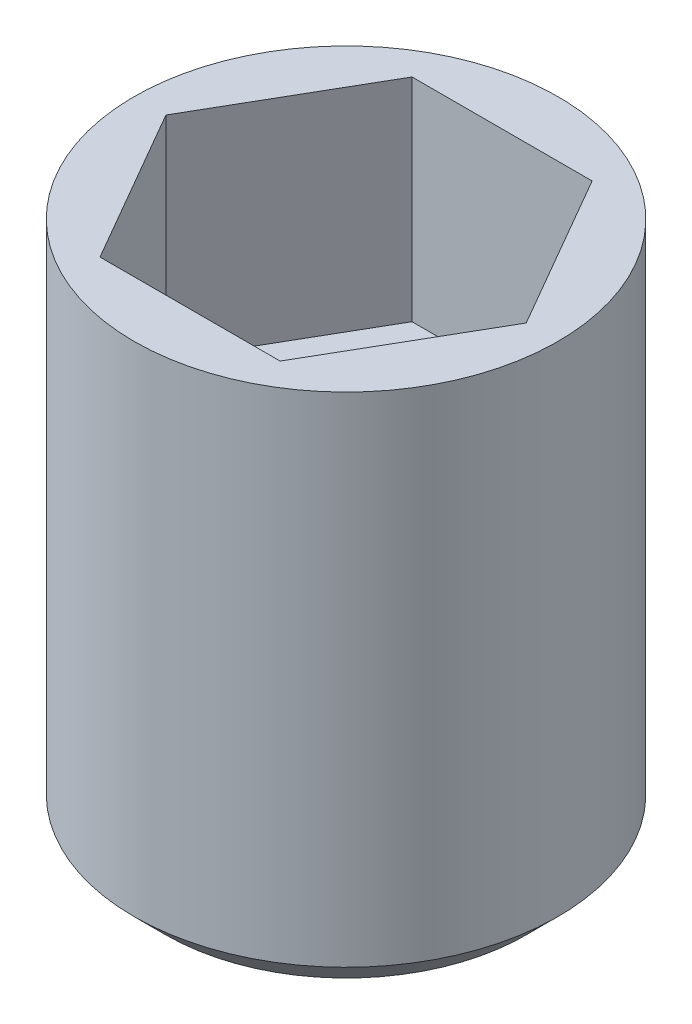
from build123d import *

# Parameters (mm, degrees)
CROQUIS1_R              = 2
SALIENTE_EXTRUIR1_DEPTH = 5
CORTAR_EXTRUIR1_DEPTH   = 2
CHAFL_N1_SIZE           = 0.3


with BuildPart() as part:
    # Croquis1 → Saliente-Extruir1 (new body)
    with BuildSketch(Plane(origin=(0, 0, 0), x_dir=(1, 0, 0), z_dir=(0, 1, 0))):
        Circle(CROQUIS1_R)
    extrude(amount=SALIENTE_EXTRUIR1_DEPTH)

    # Croquis2 → Cortar-Extruir1 (cut)
    with BuildSketch(Plane(origin=(0, 5, 0), x_dir=(1, 0, 0), z_dir=(0, 1, 0))):
        Polygon((1.699516471, 0), (0.849758236, 1.471824438), (-0.849758236, 1.471824438), (-1.699516471, 0), (-0.849758236, -1.471824438), (0.849758236, -1.471824438), align=None)
    extrude(amount=-CORTAR_EXTRUIR1_DEPTH, mode=Mode.SUBTRACT)

    # Chaflán1
    chafl_n1_edges = [part.edges().sort_by_distance(p)[0] for p in [
        (-2, 0, 0),
    ]]
    chamfer(chafl_n1_edges, length=CHAFL_N1_SIZE)


solid = part.part
